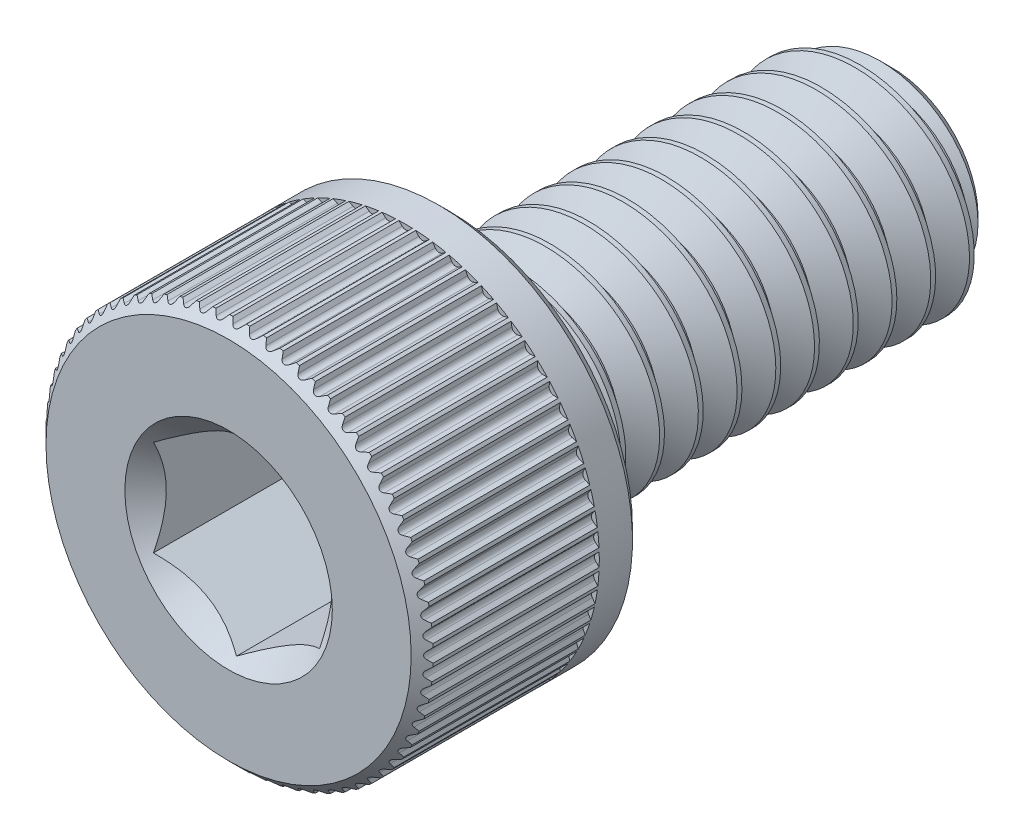
from build123d import *

# Parameters (mm, degrees)
CUT_EXTRUDE1_DEPTH     = 3
SPLIT1_SURFACE_1_BACK  = 16.556
SPLIT1_SURFACE_1_DEPTH = 33.112
SPLIT1_SURFACE_2_BACK  = 16.556
SPLIT1_SURFACE_2_DEPTH = 33.112
CUT_SWEEP1_PITCH       = 0.7
CUT_EXTRUDE3_DEPTH     = 3.2
CIRPATTERN1_COUNT      = 72


with BuildPart() as part:
    # Sketch2 → Revolve1 (revolve)
    with BuildSketch(Plane(origin=(0, 0, 0), x_dir=(0, 0, -1), z_dir=(1, 0, 0))):
        with BuildLine():
            Line((-6, 0), (-6, 3.3))
            Line((-6, 3.3), (-5.8, 3.5))
            Line((-5.8, 3.5), (-2.2, 3.5))
            Line((-2.2, 3.5), (-2, 3.3))
            Line((-2, 3.3), (-2, 2.2))
            ThreePointArc((-2, 2.2), (-1.941421356, 2.058578644), (-1.8, 2))
            Line((-1.8, 2), (5.545336663, 2))
            Line((5.545336663, 2), (6, 1.545336663))
            Line((6, 1.545336663), (6, 0))
            Line((6, 0), (-6, 0))
        make_face()
    revolve(axis=Axis((0, 0, -6), (0, 0, 1)))

    # Sketch3 → Cut-Extrude1 (cut)
    with BuildSketch(Plane.XY.offset(6)):
        Polygon((1.5, -0.866025404), (1.5, 0.866025404), (0, 1.732050808), (-1.5, 0.866025404), (-1.5, -0.866025404), (0, -1.732050808), align=None)
    extrude(amount=-CUT_EXTRUDE1_DEPTH, mode=Mode.SUBTRACT)

    # Cut-Extrude2 cone 1 section (through the dimple's axis) → Cut-Extrude2 (revolve, cut)
    with BuildSketch(Plane(origin=(0, 0, 6), x_dir=(0, -1, 0), z_dir=(1, 0, 0))):
        Polygon((0, 0), (1.875, 0), (0, 1.875), align=None)
    revolve(axis=Axis((0, 0, 6), (0, 0, -1)), mode=Mode.SUBTRACT)


with BuildPart() as body_2:
    # Split1: the piece behind the surface
    add(part.part)
    # Split1 surface: a surface, the sketch's curves swept straight by 33.112 mm
    with BuildLine(Plane(origin=(0, 0, 0), x_dir=(0, 0, -1), z_dir=(1, 0, 0)).offset(-SPLIT1_SURFACE_1_BACK), mode=Mode.PRIVATE) as split1_surface_1_path:
        Line((-1.8, -3.5), (-1.8, 3.5))
    split1_surface_1 = Shell.extrude(split1_surface_1_path.wire(), (1 * SPLIT1_SURFACE_1_DEPTH, 0 * SPLIT1_SURFACE_1_DEPTH, 0 * SPLIT1_SURFACE_1_DEPTH))
    split(bisect_by=split1_surface_1, keep=Keep.BOTTOM)

    # Cut-Sweep1: the profile of Sketch7 screwed along a right-hand helix of 12.428571 turns, 6 arcs to a turn; built about Z, then put on its axis
    cut_sweep1_z = Axis((0, 0, 0), (0, 0, 1))
    cut_sweep1_corners = [(2.037888611, 0, 0.021875), (2.037888611, 0, -0.634375), (1.545336663, 0, -0.35), (1.545336663, 0, -0.2625)]
    with BuildLine(mode=Mode.PRIVATE) as cut_sweep1_profile:
        Line(cut_sweep1_corners[0], cut_sweep1_corners[1])
        Line(cut_sweep1_corners[1], cut_sweep1_corners[2])
        Line(cut_sweep1_corners[2], cut_sweep1_corners[3])
        Line(cut_sweep1_corners[3], cut_sweep1_corners[0])
    cut_sweep1_cap = Face(cut_sweep1_profile.wire())
    cut_sweep1_turn_angles = [0, 30, 60, 90, 120, 150, 180, 210, 240, 270, 300, 330, 360]
    cut_sweep1_turn_weights = [1, 0.8660254037844387, 1, 0.8660254037844387, 1, 0.8660254037844387, 1, 0.8660254037844387, 1, 0.8660254037844387, 1, 0.8660254037844387, 1]
    cut_sweep1_turn_rails = [Edge.make_bspline([Vector(p[0], p[1], 0).rotate(cut_sweep1_z, cut_sweep1_turn_angles[k]) / cut_sweep1_turn_weights[k] + Vector(0, 0, p[2] + CUT_SWEEP1_PITCH * cut_sweep1_turn_angles[k] / 360) for k in range(13)], [0, 0, 0, 1, 1, 2, 2, 3, 3, 4, 4, 5, 5, 6, 6, 6], 2, cut_sweep1_turn_weights) for p in cut_sweep1_corners]
    cut_sweep1_turn_sides = [Face.make_surface_from_curves(cut_sweep1_turn_rails[p[0]], cut_sweep1_turn_rails[p[1]]) for p in [(0, 1), (1, 2), (2, 3), (3, 0)]]
    cut_sweep1_last_angles = [4320, 4350, 4380, 4410, 4440, 4457.142857143, 4474.285714286]
    cut_sweep1_last_weights = [1, 0.8660254037844387, 1, 0.8660254037844387, 1, 0.9555728057861561, 1]
    cut_sweep1_last_rails = [Edge.make_bspline([Vector(p[0], p[1], 0).rotate(cut_sweep1_z, cut_sweep1_last_angles[k]) / cut_sweep1_last_weights[k] + Vector(0, 0, p[2] + CUT_SWEEP1_PITCH * cut_sweep1_last_angles[k] / 360) for k in range(7)], [0, 0, 0, 1, 1, 2, 2, 3, 3, 3], 2, cut_sweep1_last_weights) for p in cut_sweep1_corners]
    cut_sweep1_last_sides = [Face.make_surface_from_curves(cut_sweep1_last_rails[p[0]], cut_sweep1_last_rails[p[1]]) for p in [(0, 1), (1, 2), (2, 3), (3, 0)]]
    cut_sweep1 = Plane(origin=(0, 0, -6), x_dir=(0, 1, 0), z_dir=(0, 0, 1)) * Solid(Shell([*[p.moved(Location((0, 0, CUT_SWEEP1_PITCH * i))) for i in range(12) for p in cut_sweep1_turn_sides], *cut_sweep1_last_sides, cut_sweep1_cap, cut_sweep1_cap.rotate(cut_sweep1_z, 4474.285714286).moved(Location((0, 0, CUT_SWEEP1_PITCH * 4474.285714286 / 360)))]))
    add(cut_sweep1, mode=Mode.SUBTRACT)


with BuildPart() as part_1:
    add(part.part)

    # Split1: split by a surface, the side it looks to stays
    # Split1 surface: a surface, the sketch's curves swept straight by 33.112 mm
    with BuildLine(Plane(origin=(0, 0, 0), x_dir=(0, 0, -1), z_dir=(1, 0, 0)).offset(-SPLIT1_SURFACE_2_BACK), mode=Mode.PRIVATE) as split1_surface_2_path:
        Line((-1.8, -3.5), (-1.8, 3.5))
    split1_surface_2 = Shell.extrude(split1_surface_2_path.wire(), (1 * SPLIT1_SURFACE_2_DEPTH, 0 * SPLIT1_SURFACE_2_DEPTH, 0 * SPLIT1_SURFACE_2_DEPTH))
    split(bisect_by=split1_surface_2, keep=Keep.TOP)

    add(body_2.part)  # Revolve2 merges body 2
    # Sketch8 → Revolve2 (revolve)
    with BuildSketch(Plane(origin=(0, 0, 0), x_dir=(0, 0, -1), z_dir=(1, 0, 0)), mode=Mode.PRIVATE) as revolve2_sk:
        Polygon((-2, 0), (-2, 2), (-1.8, 2), (-0.645299462, 0), align=None)
    revolve(revolve2_sk.sketch.rotate(Axis((0, 0, 0.645299462), (0, 0, 1)), 270), axis=Axis((0, 0, 0.645299462), (0, 0, 1)))

    # Sketch12 → Cut-Extrude3 (cut)
    with BuildSketch(Plane.XY.offset(6)):
        with BuildLine():
            Line((-0.211780344, 3.5875), (0.211780344, 3.5875))
            Line((0.211780344, 3.5875), (0.062787974, 3.438507631))
            ThreePointArc((0.062787974, 3.438507631), (0, 3.4125), (-0.062787974, 3.438507631))
            Line((-0.062787974, 3.438507631), (-0.211780344, 3.5875))
        make_face()
    cut_extrude3 = extrude(amount=-CUT_EXTRUDE3_DEPTH, mode=Mode.SUBTRACT)

    # CirPattern1: Cut-Extrude3 ×72 about axis
    cirpattern1_axis = Axis((0, 0, 0), (0, 0, 1))
    for i in range(1, CIRPATTERN1_COUNT):
        add(cut_extrude3.rotate(cirpattern1_axis, i * 360 / CIRPATTERN1_COUNT), mode=Mode.SUBTRACT)


solid = part_1.part
